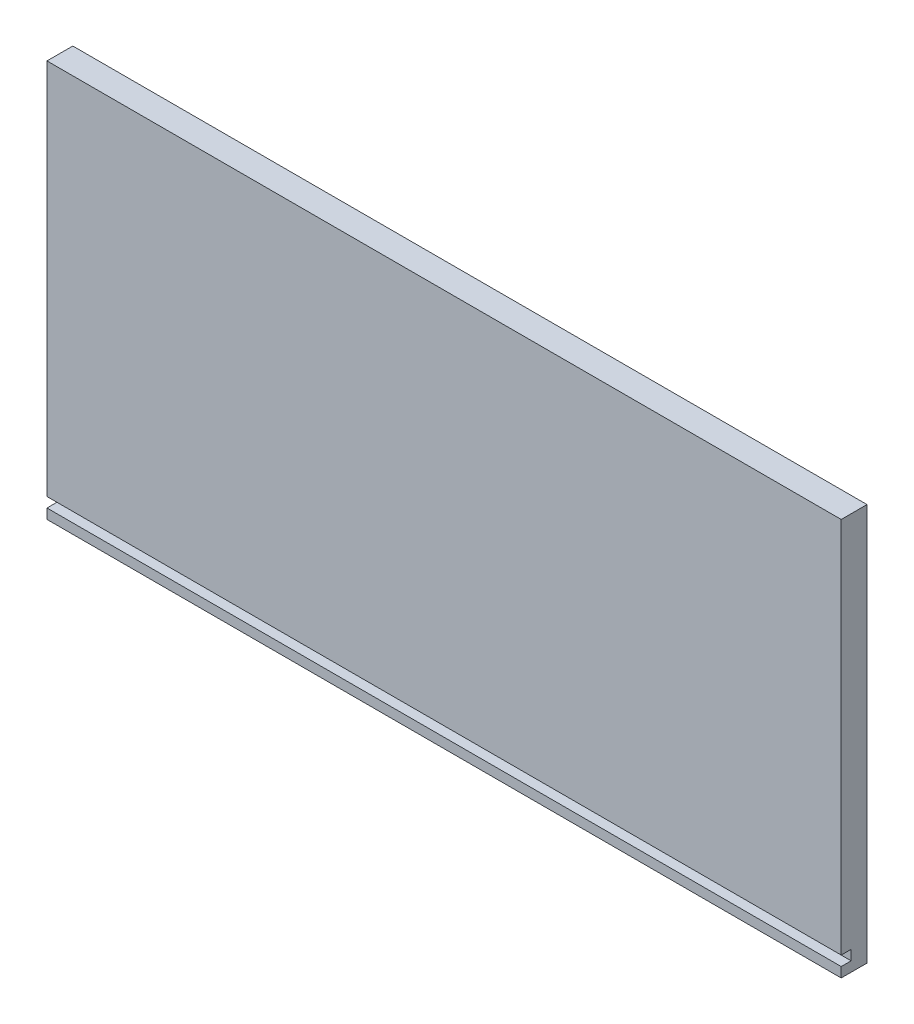
from build123d import *

# Parameters (mm, degrees)
SKETCH_1_W          = 400
SKETCH_1_H          = 200
EXTRUDE_1_DEPTH     = 13
SKETCH_2_W          = 400
SKETCH_2_H          = 5
CUT_EXTRUDE_1_DEPTH = 5


with BuildPart() as part:
    # ｽｹｯﾁ1 → ﾎﾞｽ - 押し出し1 (new body)
    with BuildSketch(Plane.XY):
        with Locations((130.719868277, 61.507142857)):
            Rectangle(SKETCH_1_W, SKETCH_1_H)
    extrude(amount=EXTRUDE_1_DEPTH)

    # ｽｹｯﾁ2 → ｶｯﾄ - 押し出し1 (cut)
    with BuildSketch(Plane.XY.offset(13)):
        with Locations((130.719868277, -30.992857143)):
            Rectangle(SKETCH_2_W, SKETCH_2_H)
    extrude(amount=-CUT_EXTRUDE_1_DEPTH, mode=Mode.SUBTRACT)


solid = part.part
